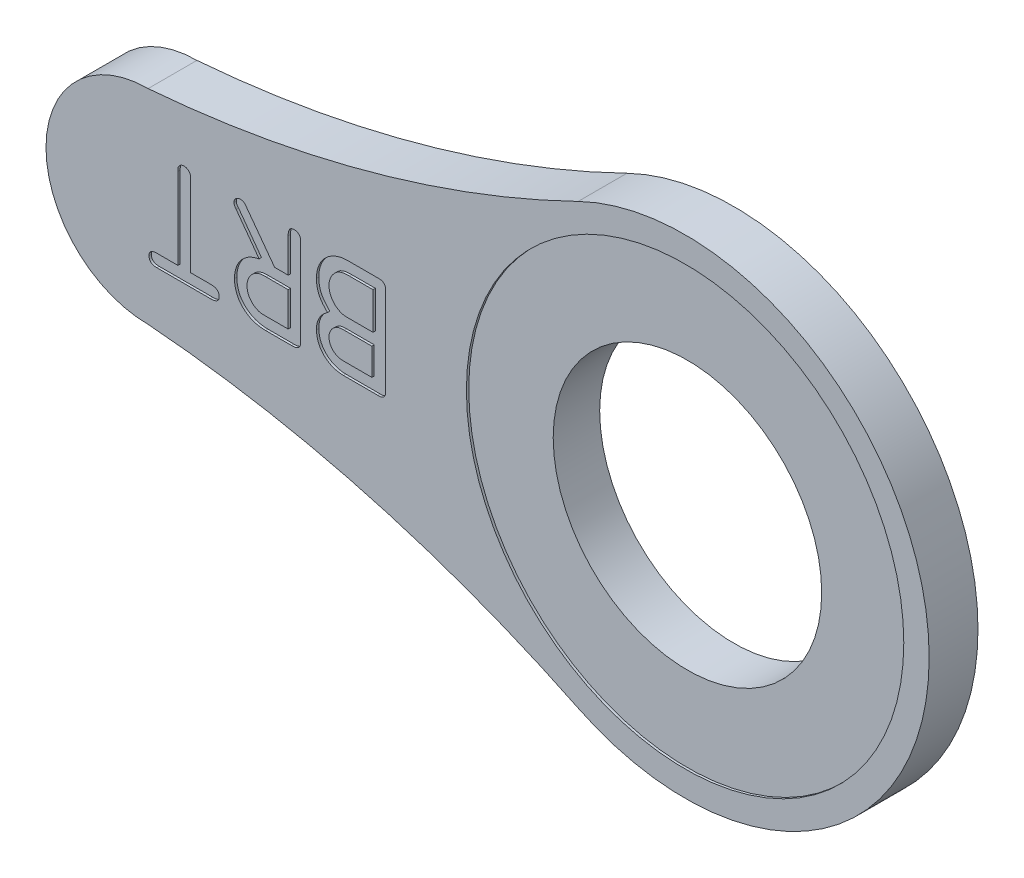
from build123d import *

# Parameters (mm, degrees)
BOSS_EXTRUDE1_DEPTH              = 1.5875
F_11_32_0_34375_DIAMETER_HOLE1_D = 8.73125
WRAP1_START                      = -0.0762
WRAP1_OUTLINE_R                  = 7.112
WRAP1_DEPTH                      = 0.0762


# Read off the part's stored shape, not the designer's step: Wrap1
with BuildPart() as part:
    # Sketch1 → Boss-Extrude1 (new body)
    with BuildSketch(Plane.XY):
        with BuildLine():
            ThreePointArc((-3.478640359, -7.13463156), (7.9375, 0), (-3.478640359, 7.13463156))
            ThreePointArc((-3.478640359, 7.13463156), (-10.291365431, 4.570684756), (-17.4625, 3.320934733))
            ThreePointArc((-17.4625, 3.320934733), (-20.783434733, 0), (-17.4625, -3.320934733))
            ThreePointArc((-17.4625, -3.320934733), (-10.291365431, -4.570684756), (-3.478640359, -7.13463156))
        make_face()
    extrude(amount=BOSS_EXTRUDE1_DEPTH)

    # 11/32 (0.34375) Diameter Hole1 (through all)
    with Locations(Plane.XY.offset(1.5875)):
        with Locations((0, 0)):
            Hole(F_11_32_0_34375_DIAMETER_HOLE1_D / 2)

    # Wrap1 outline → Wrap1 (cut)
    # profile 1 of 4: a face of its own
    with BuildSketch(Plane.XY.offset(1.5875).offset(WRAP1_START)):
        with BuildLine():
            Line((-9.738476305, -1.331770053), (-9.738193558, 1.461736119))
            add(Edge.make_bspline(
                [(-9.738193558, 1.461736119), (-9.73705221, 1.483232241), (-9.734907079, 1.523633578), (-9.743172938, 1.580342517), (-9.761273642, 1.628240855), (-9.789250453, 1.667405931), (-9.828335763, 1.696148492), (-9.876678353, 1.71446159), (-9.933954127, 1.724786232), (-9.97504176, 1.723187534), (-9.997115574, 1.722328653)],
                knots=[0, 0, 0, 0, 0.147582797, 0.277377575, 0.390383162, 0.496309094, 0.603213664, 0.71835341, 0.848688915, 1, 1, 1, 1], degree=3))
            Line((-9.997115574, 1.722328653), (-10.915124313, 1.722328653))
            add(Edge.make_bspline(
                [(-10.915124313, 1.722328653), (-10.936490067, 1.722105231), (-10.976778266, 1.721683935), (-11.034133562, 1.720840669), (-11.084879177, 1.716822979), (-11.145082983, 1.711560996), (-11.217610338, 1.698422865), (-11.27369929, 1.681469221), (-11.302525442, 1.672756127)],
                knots=[0, 0, 0, 0, 0.163340994, 0.308002918, 0.438295776, 0.552321773, 0.769921877, 1, 1, 1, 1], degree=3))
            add(Edge.make_bspline(
                [(-11.302525442, 1.672756127), (-11.328296972, 1.663548433), (-11.379106758, 1.64539503), (-11.452105958, 1.61196056), (-11.521232563, 1.574075961), (-11.585873015, 1.530722065), (-11.646710016, 1.483268452), (-11.702694954, 1.430600635), (-11.754797539, 1.373419191), (-11.802667886, 1.311979027), (-11.845791958, 1.246704273), (-11.88325774, 1.178212476), (-11.915050319, 1.106864046), (-11.940600573, 1.032681238), (-11.961836007, 0.956238815), (-11.976733849, 0.87693337), (-11.986346591, 0.79481208), (-11.987866835, 0.739047311), (-11.988637948, 0.710761733)],
                knots=[0, 0, 0, 0, 0.064828101, 0.127811654, 0.190044151, 0.251429908, 0.312055441, 0.37268363, 0.433343683, 0.495212851, 0.557071608, 0.618533394, 0.680016137, 0.74193734, 0.804304249, 0.867857939, 0.932973549, 1, 1, 1, 1], degree=3))
            add(Edge.make_bspline(
                [(-11.988637948, 0.710761733), (-11.988103407, 0.67333443), (-11.987056542, 0.60003554), (-11.970186857, 0.493008619), (-11.945085448, 0.390984798), (-11.906850216, 0.294202273), (-11.856933604, 0.200489202), (-11.794055889, 0.108709589), (-11.717934468, 0.017621853), (-11.660085795, -0.039758557), (-11.630135183, -0.06946673)],
                knots=[0, 0, 0, 0, 0.126524404, 0.247789653, 0.365729601, 0.481465815, 0.598934219, 0.724366313, 0.857293228, 1, 1, 1, 1], degree=3))
            add(Edge.make_bspline(
                [(-11.630135183, -0.06946673), (-11.658866665, -0.090916285), (-11.715031056, -0.132845943), (-11.78945763, -0.204140305), (-11.851750323, -0.281172955), (-11.903540717, -0.362518896), (-11.942453315, -0.44955339), (-11.969784003, -0.541330867), (-11.987101018, -0.637812618), (-11.988120507, -0.704016428), (-11.988637948, -0.737618176)],
                knots=[0, 0, 0, 0, 0.135810624, 0.265483038, 0.389378624, 0.510510391, 0.629950416, 0.749404235, 0.872810106, 1, 1, 1, 1], degree=3))
            add(Edge.make_bspline(
                [(-11.988637948, -0.737618176), (-11.987258625, -0.767361399), (-11.984543315, -0.825913321), (-11.97132951, -0.911514889), (-11.951409152, -0.993451838), (-11.923217601, -1.071132352), (-11.887919466, -1.144831405), (-11.845284634, -1.214165035), (-11.795213523, -1.279406955), (-11.738063354, -1.339941359), (-11.675107042, -1.395135814), (-11.607265763, -1.443589711), (-11.534695307, -1.484716753), (-11.458124439, -1.519389532), (-11.376764895, -1.545675871), (-11.291621242, -1.566322654), (-11.201771823, -1.578122241), (-11.140426834, -1.581029572), (-11.109264432, -1.582506456)],
                knots=[0, 0, 0, 0, 0.06566853, 0.12927377, 0.190798733, 0.251482665, 0.311285729, 0.370836064, 0.430769753, 0.492457925, 0.554254663, 0.615259919, 0.676090953, 0.738068212, 0.800404945, 0.864497924, 0.931166829, 1, 1, 1, 1], degree=3))
            Line((-11.109264432, -1.582506456), (-9.991457138, -1.582505754))
            add(Edge.make_bspline(
                [(-9.991457138, -1.582505754), (-9.971036451, -1.582712636), (-9.932553732, -1.583102503), (-9.878478104, -1.573290762), (-9.832820842, -1.554531293), (-9.794869328, -1.5273478), (-9.767441427, -1.489812955), (-9.74734476, -1.444663172), (-9.73798301, -1.390575384), (-9.738305365, -1.352147629), (-9.738476305, -1.331770053)],
                knots=[0, 0, 0, 0, 0.146872315, 0.276780402, 0.392748169, 0.500040194, 0.608367147, 0.72343343, 0.853341517, 1, 1, 1, 1], degree=3))
        make_face()
        with BuildLine():
            Line((-10.185129288, -1.174429761), (-11.06410289, -1.174429761))
            add(Edge.make_bspline(
                [(-11.06410289, -1.174429761), (-11.084186239, -1.174524586), (-11.118886062, -1.174688425), (-11.165403465, -1.173775124), (-11.203822232, -1.169558057), (-11.226913351, -1.163250355), (-11.238584067, -1.160062316)],
                knots=[0, 0, 0, 0, 0.342696843, 0.592108394, 0.793843364, 1, 1, 1, 1], degree=3))
            add(Edge.make_bspline(
                [(-11.238584067, -1.160062316), (-11.262821731, -1.153710977), (-11.310627386, -1.141183783), (-11.376498883, -1.108193306), (-11.43517515, -1.064838343), (-11.486023104, -1.012053752), (-11.526505732, -0.950857635), (-11.557830712, -0.884599607), (-11.575714048, -0.81252245), (-11.578929069, -0.76285483), (-11.580562657, -0.737618176)],
                knots=[0, 0, 0, 0, 0.127627835, 0.25172939, 0.373245149, 0.498610664, 0.623719631, 0.746239669, 0.871061634, 1, 1, 1, 1], degree=3))
            add(Edge.make_bspline(
                [(-11.580562657, -0.737618176), (-11.579730122, -0.716483798), (-11.578077505, -0.674531163), (-11.565035128, -0.613383425), (-11.542749405, -0.555626388), (-11.513449187, -0.501195372), (-11.477027675, -0.450857463), (-11.433416356, -0.40658916), (-11.383368731, -0.368825968), (-11.346397667, -0.348950196), (-11.327670927, -0.338882635)],
                knots=[0, 0, 0, 0, 0.127241511, 0.252579791, 0.374483954, 0.499056142, 0.623995308, 0.747426301, 0.872065292, 1, 1, 1, 1], degree=3))
            add(Edge.make_bspline(
                [(-11.327670927, -0.338882635), (-11.311630572, -0.331026386), (-11.278944248, -0.315017267), (-11.221382053, -0.302709107), (-11.152814816, -0.295669951), (-11.102348852, -0.295277584), (-11.074060754, -0.295057648)],
                knots=[0, 0, 0, 0, 0.205294923, 0.41834091, 0.673957892, 1, 1, 1, 1], degree=3))
            Line((-11.074060754, -0.295057648), (-10.185129288, -0.295057648))
            Line((-10.185129288, -0.295057648), (-10.185129288, -1.174429761))
        make_face(mode=Mode.SUBTRACT)
        with BuildLine():
            Line((-10.15036762, 0.113018345), (-10.954851933, 0.113018345))
            add(Edge.make_bspline(
                [(-10.954851933, 0.113018345), (-10.979266146, 0.112936987), (-11.02217896, 0.112793985), (-11.081143477, 0.116684488), (-11.131928419, 0.126355383), (-11.163033706, 0.137492344), (-11.178953347, 0.143192225)],
                knots=[0, 0, 0, 0, 0.321598957, 0.565273851, 0.777507799, 1, 1, 1, 1], degree=3))
            add(Edge.make_bspline(
                [(-11.178953347, 0.143192225), (-11.207737605, 0.154369706), (-11.264842537, 0.17654465), (-11.341051833, 0.228061725), (-11.411026793, 0.28833722), (-11.468563161, 0.362287329), (-11.518247618, 0.442350396), (-11.552067742, 0.5299922), (-11.576012207, 0.621135402), (-11.579035463, 0.684023165), (-11.580562657, 0.71579083)],
                knots=[0, 0, 0, 0, 0.124076016, 0.246153726, 0.368551532, 0.494871041, 0.622163992, 0.746910198, 0.872152044, 1, 1, 1, 1], degree=3))
            add(Edge.make_bspline(
                [(-11.580562657, 0.71579083), (-11.579377147, 0.742454672), (-11.577017524, 0.795526003), (-11.560556242, 0.873217465), (-11.535304323, 0.948394643), (-11.499941353, 1.019495656), (-11.457366855, 1.086721889), (-11.405716993, 1.145960912), (-11.348789559, 1.200054829), (-11.305168336, 1.228669302), (-11.283127497, 1.243127562)],
                knots=[0, 0, 0, 0, 0.12661137, 0.252005467, 0.375768368, 0.502461495, 0.628375784, 0.752639668, 0.875014295, 1, 1, 1, 1], degree=3))
            add(Edge.make_bspline(
                [(-11.283127497, 1.243127562), (-11.259242919, 1.254665941), (-11.210255513, 1.278331221), (-11.142589943, 1.296335976), (-11.082639942, 1.305769782), (-11.030771176, 1.310194802), (-10.972585276, 1.314367222), (-10.931818907, 1.314292752), (-10.910255883, 1.314253362)],
                knots=[0, 0, 0, 0, 0.207036094, 0.424632223, 0.544071651, 0.681385478, 0.831471565, 1, 1, 1, 1], degree=3))
            Line((-10.910255883, 1.314253362), (-10.15036762, 1.314253362))
            Line((-10.15036762, 1.314253362), (-10.15036762, 0.113018345))
        make_face(mode=Mode.SUBTRACT)
    # profile 2 of 4: a face of its own
    with BuildSketch(Plane.XY.offset(1.5875).offset(WRAP1_START)):
        with BuildLine():
            add(Edge.make_bspline(
                [(-13.853277358, 0.328346201), (-13.883223634, 0.321894114), (-13.942061182, 0.309217244), (-14.02706792, 0.283258125), (-14.107122818, 0.251647176), (-14.182532861, 0.214166253), (-14.253010426, 0.170052976), (-14.319294536, 0.120521454), (-14.380859373, 0.064927368), (-14.436492783, 0.003213943), (-14.486708493, -0.063030958), (-14.531834085, -0.132701448), (-14.568985797, -0.206800713), (-14.599298373, -0.284614936), (-14.623760757, -0.365773709), (-14.64181077, -0.450801165), (-14.652611318, -0.539534734), (-14.654523871, -0.59988752), (-14.655496193, -0.630570256)],
                knots=[0, 0, 0, 0, 0.067306555, 0.132241911, 0.195089406, 0.25629093, 0.317049495, 0.377579643, 0.437947091, 0.499058014, 0.559905429, 0.620499621, 0.681230821, 0.741733501, 0.803844927, 0.867332755, 0.932553336, 1, 1, 1, 1], degree=3))
            add(Edge.make_bspline(
                [(-14.655496193, -0.630570256), (-14.65393788, -0.665344279), (-14.650894483, -0.73325824), (-14.63636008, -0.832387459), (-14.613521292, -0.926313427), (-14.581593632, -1.014981613), (-14.542302136, -1.098874559), (-14.493584079, -1.177026892), (-14.436509635, -1.25001296), (-14.371184518, -1.317081859), (-14.299518232, -1.378315343), (-14.22146629, -1.431728843), (-14.137836454, -1.477028627), (-14.049019103, -1.514404419), (-13.954872022, -1.544426351), (-13.854807623, -1.564365302), (-13.749693642, -1.578677217), (-13.677745404, -1.581213223), (-13.641055503, -1.582506456)],
                knots=[0, 0, 0, 0, 0.066972661, 0.130798174, 0.192516203, 0.252737171, 0.311918725, 0.370508413, 0.429619903, 0.489932553, 0.550435175, 0.610788332, 0.67164119, 0.73320235, 0.79604133, 0.861499127, 0.929371679, 1, 1, 1, 1], degree=3))
            Line((-13.641055503, -1.582506456), (-12.800095503, -1.582505754))
            add(Edge.make_bspline(
                [(-12.800095503, -1.582505754), (-12.775269603, -1.582860483), (-12.728750889, -1.583525174), (-12.663868782, -1.572084914), (-12.608801699, -1.551492724), (-12.563960103, -1.519934085), (-12.530691194, -1.477350556), (-12.508895142, -1.425092358), (-12.498611637, -1.363540353), (-12.499628146, -1.319824205), (-12.500168948, -1.296566375)],
                knots=[0, 0, 0, 0, 0.152562747, 0.285871711, 0.403042079, 0.511865096, 0.618926373, 0.731199638, 0.856993042, 1, 1, 1, 1], degree=3))
            Line((-12.500168948, -1.296566375), (-12.500168246, 1.434525112))
            add(Edge.make_bspline(
                [(-12.500168246, 1.434525112), (-12.500068667, 1.454308908), (-12.499907587, 1.486311152), (-12.500684055, 1.526191526), (-12.501616783, 1.552430229), (-12.504114722, 1.566201691), (-12.505198045, 1.572174189)],
                knots=[0, 0, 0, 0, 0.430215932, 0.695916786, 0.868123225, 1, 1, 1, 1], degree=3))
            add(Edge.make_bspline(
                [(-12.505198045, 1.572174189), (-12.507833528, 1.583126999), (-12.513010942, 1.60464382), (-12.52902754, 1.633774434), (-12.54890034, 1.660058514), (-12.574806491, 1.681599513), (-12.603812913, 1.699397593), (-12.636053638, 1.712562325), (-12.6707697, 1.720593297), (-12.694824088, 1.721742902), (-12.707080363, 1.722328653)],
                knots=[0, 0, 0, 0, 0.123366308, 0.242353374, 0.36247188, 0.483882792, 0.610358729, 0.735566843, 0.865265096, 1, 1, 1, 1], degree=3))
            add(Edge.make_bspline(
                [(-12.707080363, 1.722328653), (-12.72295389, 1.722349131), (-12.753282998, 1.722388258), (-12.79589398, 1.710789475), (-12.831848749, 1.689781898), (-12.861749282, 1.660253024), (-12.883011787, 1.62031345), (-12.898838386, 1.572524385), (-12.90675066, 1.515671151), (-12.907724914, 1.475202816), (-12.90824424, 1.45363119)],
                knots=[0, 0, 0, 0, 0.122837245, 0.234701731, 0.338019873, 0.443194973, 0.556426239, 0.685774509, 0.832502255, 1, 1, 1, 1], degree=3))
            Line((-12.90824424, 1.45363119), (-12.90824424, 0.342919918))
            Line((-12.90824424, 0.342919918), (-13.347912054, 0.342919918))
            Line((-13.347912054, 0.342919918), (-14.271709727, 1.591864001))
            add(Edge.make_bspline(
                [(-14.271709727, 1.591864001), (-14.279493795, 1.602195844), (-14.294113995, 1.621601329), (-14.317219316, 1.647035105), (-14.339449591, 1.667115074), (-14.367217249, 1.688171447), (-14.408682767, 1.703165206), (-14.443192746, 1.704419849), (-14.461516741, 1.705086035)],
                knots=[0, 0, 0, 0, 0.167316355, 0.31425709, 0.443690142, 0.554630993, 0.763519441, 1, 1, 1, 1], degree=3))
            add(Edge.make_bspline(
                [(-14.461516741, 1.705086035), (-14.475963665, 1.704175583), (-14.50383816, 1.702418919), (-14.543504079, 1.691201876), (-14.579265247, 1.67396724), (-14.61040714, 1.64988447), (-14.63629754, 1.620732256), (-14.655287599, 1.586633926), (-14.668190233, 1.548882854), (-14.669773454, 1.521991401), (-14.670583484, 1.508232814)],
                knots=[0, 0, 0, 0, 0.135646111, 0.261721227, 0.384460861, 0.506393874, 0.629133508, 0.747998268, 0.871067295, 1, 1, 1, 1], degree=3))
            add(Edge.make_bspline(
                [(-14.670583484, 1.508232814), (-14.670021454, 1.497166134), (-14.668865854, 1.474411738), (-14.659313606, 1.440213639), (-14.641383309, 1.406636308), (-14.625191045, 1.386093176), (-14.616700302, 1.375320967)],
                knots=[0, 0, 0, 0, 0.226314244, 0.465328726, 0.719634264, 1, 1, 1, 1], degree=3))
            add(Edge.make_bspline(
                [(-14.616700302, 1.375320967), (-14.612064213, 1.37101792), (-14.60432951, 1.363838856), (-14.599312308, 1.354596515), (-14.597302357, 1.350893925)],
                knots=[0, 0, 0, 0, 0.599388267, 1, 1, 1, 1], degree=3))
            Line((-14.597302357, 1.350893925), (-13.853277358, 0.328346201))
        make_face()
        with BuildLine():
            Line((-12.90824424, -1.174429761), (-13.65618489, -1.174429761))
            add(Edge.make_bspline(
                [(-13.65618489, -1.174429761), (-13.685158961, -1.174143096), (-13.737011007, -1.173630079), (-13.808467562, -1.167199249), (-13.869507437, -1.152285114), (-13.905877172, -1.136412996), (-13.924121814, -1.12845085)],
                knots=[0, 0, 0, 0, 0.31672138, 0.566805091, 0.782690566, 1, 1, 1, 1], degree=3))
            add(Edge.make_bspline(
                [(-13.924121814, -1.12845085), (-13.947792245, -1.116483503), (-13.994547569, -1.092844847), (-14.056889243, -1.044695539), (-14.112524806, -0.98942548), (-14.159992672, -0.926043115), (-14.197851466, -0.856777188), (-14.225450002, -0.783000083), (-14.24339601, -0.705651566), (-14.246068428, -0.652460445), (-14.247420901, -0.625541159)],
                knots=[0, 0, 0, 0, 0.125937624, 0.248759913, 0.372828307, 0.498156311, 0.624093935, 0.747042986, 0.871981973, 1, 1, 1, 1], degree=3))
            add(Edge.make_bspline(
                [(-14.247420901, -0.625541159), (-14.246263659, -0.5986372), (-14.243990673, -0.545794023), (-14.227564322, -0.468671884), (-14.201550733, -0.395431816), (-14.165659556, -0.326422754), (-14.120497218, -0.263420263), (-14.067550899, -0.20764148), (-14.007429459, -0.15908715), (-13.962150447, -0.13441405), (-13.939209105, -0.121913026)],
                knots=[0, 0, 0, 0, 0.129766173, 0.254879106, 0.378796041, 0.503887621, 0.628963185, 0.751585361, 0.874136719, 1, 1, 1, 1], degree=3))
            add(Edge.make_bspline(
                [(-13.939209105, -0.121913026), (-13.918432345, -0.111815724), (-13.876714649, -0.091541332), (-13.819095532, -0.077412889), (-13.769010731, -0.071318229), (-13.725230595, -0.066373343), (-13.675056149, -0.065885686), (-13.63961479, -0.065407862), (-13.620939115, -0.065156075)],
                knots=[0, 0, 0, 0, 0.211517219, 0.424705819, 0.540004973, 0.674697536, 0.82858323, 1, 1, 1, 1], degree=3))
            Line((-13.620939115, -0.065156075), (-12.90824424, -0.065156075))
            Line((-12.90824424, -0.065156075), (-12.90824424, -1.174429761))
        make_face(mode=Mode.SUBTRACT)
    # profile 3 of 4: a face of its own
    with BuildSketch(Plane.XY.offset(1.5875).offset(WRAP1_START)):
        with BuildLine():
            Line((-16.494708775, -1.174429761), (-17.160146417, -1.174429761))
            add(Edge.make_bspline(
                [(-17.160146417, -1.174429761), (-17.181669554, -1.174936592), (-17.222093571, -1.175888505), (-17.278532804, -1.183938254), (-17.326438802, -1.199076399), (-17.366348013, -1.220214967), (-17.396673913, -1.249461145), (-17.419344419, -1.284071715), (-17.431361904, -1.325994869), (-17.432901319, -1.35564871), (-17.433713012, -1.371284386)],
                knots=[0, 0, 0, 0, 0.167971449, 0.315478223, 0.443154446, 0.558617182, 0.664383729, 0.768602998, 0.877990561, 1, 1, 1, 1], degree=3))
            add(Edge.make_bspline(
                [(-17.433713012, -1.371284386), (-17.432640342, -1.387886994), (-17.43061802, -1.419188151), (-17.418362551, -1.463322294), (-17.397281884, -1.500465845), (-17.368130781, -1.531377003), (-17.330486629, -1.554162466), (-17.28542833, -1.570833046), (-17.232715193, -1.580542176), (-17.194991824, -1.581827696), (-17.175073742, -1.582506456)],
                knots=[0, 0, 0, 0, 0.131131528, 0.247224321, 0.358152023, 0.46514253, 0.578980879, 0.702242834, 0.842783085, 1, 1, 1, 1], degree=3))
            Line((-17.175073742, -1.582506456), (-15.44105895, -1.582505754))
            add(Edge.make_bspline(
                [(-15.44105895, -1.582505754), (-15.418162231, -1.582431058), (-15.375354114, -1.582291404), (-15.315673846, -1.572583529), (-15.265041956, -1.558226986), (-15.222844541, -1.537275025), (-15.190529039, -1.508697864), (-15.166999725, -1.473750797), (-15.154874688, -1.431683003), (-15.153893713, -1.402008622), (-15.153376786, -1.386371677)],
                knots=[0, 0, 0, 0, 0.172501325, 0.32251157, 0.454558427, 0.568503244, 0.674737962, 0.776467345, 0.882209234, 1, 1, 1, 1], degree=3))
            add(Edge.make_bspline(
                [(-15.153376786, -1.386371677), (-15.154031583, -1.369720711), (-15.155269555, -1.338240061), (-15.169170448, -1.294735818), (-15.188839407, -1.256672881), (-15.219345907, -1.22642811), (-15.257242485, -1.202414806), (-15.30370489, -1.186334081), (-15.357462465, -1.176299631), (-15.395919641, -1.175078925), (-15.41632671, -1.174431164)],
                knots=[0, 0, 0, 0, 0.129332967, 0.244519501, 0.353162993, 0.460124495, 0.575129251, 0.70036667, 0.84100137, 1, 1, 1, 1], degree=3))
            Line((-15.41632671, -1.174431164), (-16.086632782, -1.174429761))
            Line((-16.086632782, -1.174429761), (-16.086632782, 1.445729727))
            add(Edge.make_bspline(
                [(-16.086632782, 1.445729727), (-16.086545476, 1.46369172), (-16.086403444, 1.492912736), (-16.087110824, 1.530276587), (-16.088382644, 1.55740982), (-16.090589344, 1.573143411), (-16.091662581, 1.580795497)],
                knots=[0, 0, 0, 0, 0.39825534, 0.647891671, 0.82875089, 1, 1, 1, 1], degree=3))
            add(Edge.make_bspline(
                [(-16.091662581, 1.580795497), (-16.094862635, 1.59078805), (-16.101217937, 1.610633245), (-16.117701868, 1.63730041), (-16.138046752, 1.66190823), (-16.172585377, 1.6885276), (-16.222565576, 1.716358845), (-16.267723468, 1.72031717), (-16.290671129, 1.722328653)],
                knots=[0, 0, 0, 0, 0.120094053, 0.23850661, 0.357556485, 0.484719938, 0.738152689, 1, 1, 1, 1], degree=3))
            add(Edge.make_bspline(
                [(-16.290671129, 1.722328653), (-16.311001804, 1.72076601), (-16.349425343, 1.717812725), (-16.402256266, 1.696701465), (-16.44596866, 1.662718007), (-16.465385068, 1.631803051), (-16.47531083, 1.615999176)],
                knots=[0, 0, 0, 0, 0.271915119, 0.513900381, 0.751503514, 1, 1, 1, 1], degree=3))
            add(Edge.make_bspline(
                [(-16.47531083, 1.615999176), (-16.478622903, 1.607687733), (-16.485399178, 1.590683084), (-16.492600618, 1.560581189), (-16.4944906, 1.519977193), (-16.494627018, 1.488825147), (-16.494708775, 1.470155366)],
                knots=[0, 0, 0, 0, 0.180763716, 0.369830308, 0.62233202, 1, 1, 1, 1], degree=3))
            Line((-16.494708775, 1.470155366), (-16.494708775, -1.174429761))
        make_face()
    # profile 4 of 4: a face of its own
    with BuildSketch(Plane.XY.offset(1.5875).offset(WRAP1_START)):
        Circle(WRAP1_OUTLINE_R)
    extrude(amount=WRAP1_DEPTH, mode=Mode.SUBTRACT)


solid = part.part
